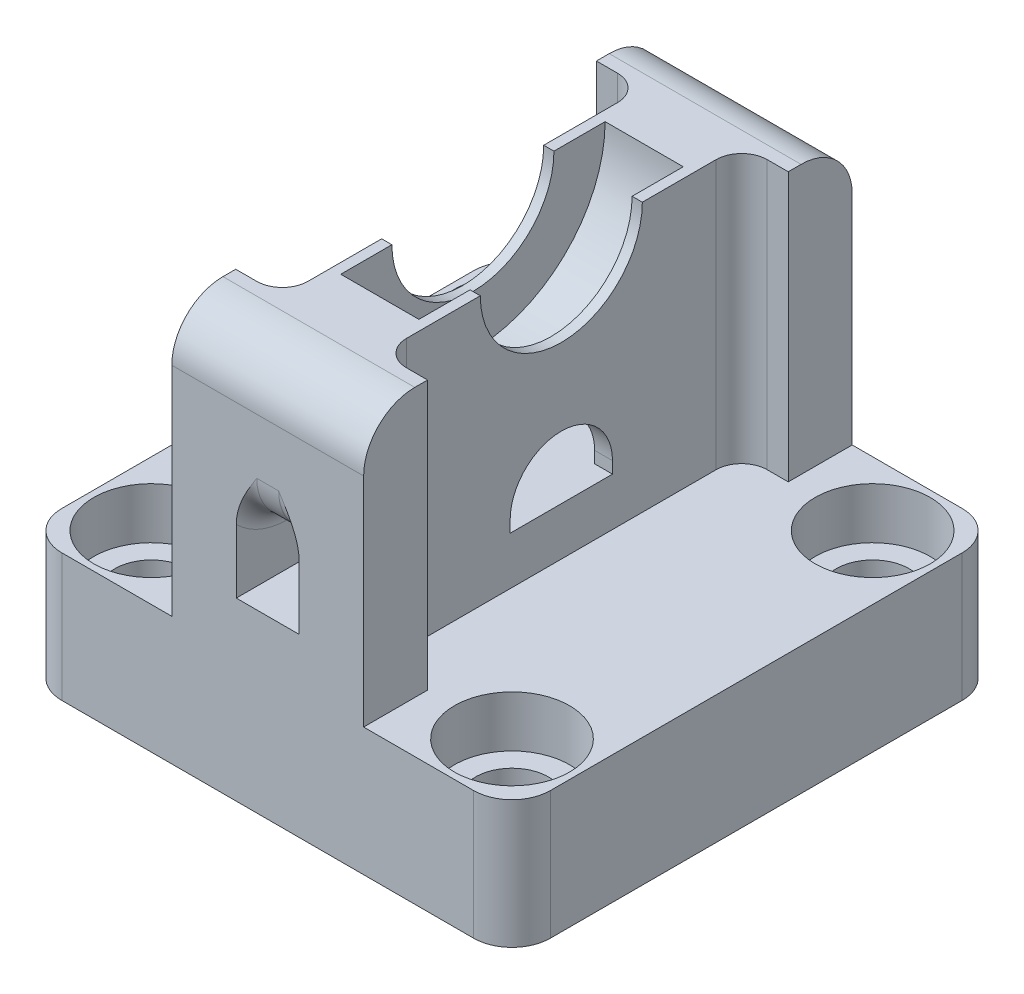
from build123d import *

# Parameters (mm, degrees)
SKETCH1_W           = 48.514
SKETCH1_H           = 48.514
SKETCH1_R           = 3.6195
BOSS_EXTRUDE1_DEPTH = 12.7
FILLET1_R           = 3.81
SKETCH4_R           = 5.715
CUT_EXTRUDE2_DEPTH  = 5.08
BOSS_EXTRUDE3_DEPTH = 26.67
SKETCH8_R           = 13.12545
CUT_EXTRUDE4_DEPTH  = 7.762
SKETCH11_W          = 6.238
SKETCH11_H          = 6.238
CUT_EXTRUDE7_DEPTH  = 68.022437624
SKETCH13_W          = 5.08
SKETCH13_H          = 6.238
CUT_EXTRUDE8_DEPTH  = 55.130822948
SKETCH14_W          = 10.16
SKETCH14_H          = 6.238
BOSS_EXTRUDE4_DEPTH = 1.016
FILLET3_R           = 5.08
FILLET2_R           = 2.54
FILLET4_R           = 2.032
FILLET6_R           = 5.08


# Some blends are built 0.0001 mm under size
with BuildPart() as part:
    # Sketch1 → Boss-Extrude1 (new body)
    with BuildSketch(Plane(origin=(0, 0, 0), x_dir=(1, 0, 0), z_dir=(0, 1, 0))):
        Rectangle(SKETCH1_W, SKETCH1_H)
        with Locations(Location((-17.907, 17.907, 0), (0, 0, 270))):
            Circle(SKETCH1_R, mode=Mode.SUBTRACT)
        with Locations(Location((17.907, 17.907, 0), (0, 0, 270))):
            Circle(SKETCH1_R, mode=Mode.SUBTRACT)
        with Locations(Location((17.907, -17.907, 0), (0, 0, 270))):
            Circle(SKETCH1_R, mode=Mode.SUBTRACT)
        with Locations(Location((-17.907, -17.907, 0), (0, 0, 270))):
            Circle(SKETCH1_R, mode=Mode.SUBTRACT)
    extrude(amount=BOSS_EXTRUDE1_DEPTH)

    # Fillet1
    fillet1_edges = [part.edges().sort_by_distance(p)[0] for p in [
        (24.257, 6.35, 24.257),
        (-24.257, 6.35, 24.257),
        (-24.257, 6.35, -24.257),
        (24.257, 6.35, -24.257),
    ]]
    fillet(fillet1_edges, radius=FILLET1_R)

    # Sketch4 → Cut-Extrude2 (cut)
    with BuildSketch(Plane(origin=(0, 12.7, 0), x_dir=(1, 0, 0), z_dir=(0, 1, 0))):
        with Locations(Location((-17.907, 17.907, 0), (0, 0, 270))):
            Circle(SKETCH4_R)
        with Locations(Location((17.907, -17.907, 0), (0, 0, 270))):
            Circle(SKETCH4_R)
        with Locations(Location((17.907, 17.907, 0), (0, 0, 270))):
            Circle(SKETCH4_R)
        with Locations(Location((-17.907, -17.907, 0), (0, 0, 270))):
            Circle(SKETCH4_R)
    extrude(amount=-CUT_EXTRUDE2_DEPTH, mode=Mode.SUBTRACT)

    # Sketch6 → Boss-Extrude3 (add)
    with BuildSketch(Plane(origin=(0, 12.7, 0), x_dir=(1, 0, 0), z_dir=(0, 1, 0))):
        Polygon((-3.881, 17.907), (-3.881, -17.907), (-9.525, -17.907), (-9.525, -24.257), (9.525, -24.257), (9.525, -17.907), (3.881, -17.907), (3.881, 17.907), (9.525, 17.907), (9.525, 24.257), (-9.525, 24.257), (-9.525, 17.907), align=None)
    extrude(amount=BOSS_EXTRUDE3_DEPTH)

    # Sketch8 → Cut-Extrude4 (cut)
    with BuildSketch(Plane(origin=(3.881, 0, 0), x_dir=(0, 0, -1), z_dir=(1, 0, 0))):
        with Locations((0, 39.37)):
            Circle(SKETCH8_R)
    extrude(amount=-CUT_EXTRUDE4_DEPTH, mode=Mode.SUBTRACT)

    # Sketch11 → Cut-Extrude7 (cut, through all)
    with BuildSketch(Plane.XY.offset(24.257)):
        with Locations((0, 20.58555)):
            Rectangle(SKETCH11_W, SKETCH11_H)
    extrude(amount=-CUT_EXTRUDE7_DEPTH, mode=Mode.SUBTRACT)

    # Sketch13 → Cut-Extrude8 (cut, through all)
    with BuildSketch(Plane(origin=(3.881, 0, 0), x_dir=(0, 0, -1), z_dir=(1, 0, 0))):
        with Locations((-2.54, 20.58555)):
            Rectangle(SKETCH13_W, SKETCH13_H)
        with Locations((2.54, 20.58555)):
            Rectangle(SKETCH13_W, SKETCH13_H)
    extrude(amount=-CUT_EXTRUDE8_DEPTH, mode=Mode.SUBTRACT)

    # Sketch14 → Boss-Extrude4 (add)
    with BuildSketch(Plane(origin=(3.881, 0, 0), x_dir=(0, 0, -1), z_dir=(1, 0, 0))):
        with BuildLine():
            Line((17.907, 39.37), (8.04545, 39.37))
            ThreePointArc((8.04545, 39.37), (0, 31.32455), (-8.04545, 39.37))
            Line((-8.04545, 39.37), (-17.907, 39.37))
            Line((-17.907, 39.37), (-17.907, 12.7))
            Line((-17.907, 12.7), (17.907, 12.7))
            Line((17.907, 12.7), (17.907, 39.37))
        make_face()
        with Locations((0, 20.58555)):
            Rectangle(SKETCH14_W, SKETCH14_H, mode=Mode.SUBTRACT)
    boss_extrude4 = extrude(amount=BOSS_EXTRUDE4_DEPTH)

    # Mirror1: Boss-Extrude4 across plane
    add(boss_extrude4.mirror(Plane(origin=(0, 0, 0), x_dir=(0, 0, 1), z_dir=(1, 0, 0))))

    # Fillet3
    fillet3_edges = [part.edges().sort_by_distance(p)[0] for p in [
        (0, 23.70455, -24.257),
        (0, 23.70455, 24.257),
        (0, 39.37, 24.257),
        (0, 39.37, -24.257),
    ]]
    fillet(fillet3_edges, radius=FILLET3_R)

    # Fillet2
    fillet2_edges = [part.edges().sort_by_distance(p)[0] for p in [
        (4.897, 26.035, -17.907),
        (4.897, 26.035, 17.907),
        (-4.897, 26.035, -17.907),
        (-4.897, 26.035, 17.907),
    ]]
    fillet(fillet2_edges, radius=FILLET2_R)

    # Fillet4
    # the kernel refuses this fillet: 2.032 mm, written as the material it adds along each edge
    with BuildSketch(Plane(origin=(3.119, 23.70455, 19.177), x_dir=(-1, 0, 0), z_dir=(0, 0, -1)), Plane(origin=(3.119, 23.70455, -5.08), x_dir=(-1, 0, 0), z_dir=(0, 0, -1))) as fillet4_piece_1:
        with BuildLine():
            CenterArc((FILLET4_R, -FILLET4_R), FILLET4_R, 90, 90)
            Line((0, -FILLET4_R), (0, 0))
            Line((0, 0), (FILLET4_R, 0))
        make_face()
    extrude(amount=14.097)
    with BuildSketch(Plane(origin=(-3.119, 23.70455, 19.177), x_dir=(1, 0, 0), z_dir=(0, 0, -1)), Plane(origin=(-3.119, 23.70455, -5.08), x_dir=(1, 0, 0), z_dir=(0, 0, -1))) as fillet4_piece_2:
        with BuildLine():
            CenterArc((FILLET4_R, FILLET4_R), FILLET4_R, 180, 90)
            Line((0, FILLET4_R), (0, 0))
            Line((0, 0), (FILLET4_R, 0))
        make_face()
    extrude(amount=14.097)
    with BuildSketch(Plane(origin=(-3.119, 28.78455, -19.177), x_dir=(0, 0.8416879607506225, -0.5399642365263265), z_dir=(0, 0.5399642365263265, 0.8416879607506225))) as fillet4_piece_3_section:
        with BuildLine():
            CenterArc((5.08 + FILLET4_R, -FILLET4_R), FILLET4_R, 90, 90)
            Line((5.08, -FILLET4_R), (5.08, 0))
            Line((5.08, 0), (5.08 + FILLET4_R, 0))
        make_face()
    fillet4_piece_3 = revolve(axis=Axis((-3.119, 28.78455, -19.177), (-1, 0, 0)), revolution_arc=147.318795695, mode=Mode.PRIVATE)
    fillet4_piece_3 = split(fillet4_piece_3, bisect_by=Plane(origin=(-3.119, 28.78455, -24.257), z_dir=(0, 0, 1)), keep=Keep.TOP, mode=Mode.PRIVATE)
    add(fillet4_piece_3)
    with BuildSketch(Plane(origin=(3.119, 28.78455, -19.177), x_dir=(0, 0.8416879607506221, -0.5399642365263271), z_dir=(0, 0.5399642365263271, 0.8416879607506221))) as fillet4_piece_4_section:
        with BuildLine():
            CenterArc((5.08 + FILLET4_R, FILLET4_R), FILLET4_R, 180, 90)
            Line((5.08 + FILLET4_R, 0), (5.08, 0))
            Line((5.08, 0), (5.08, FILLET4_R))
        make_face()
    fillet4_piece_4 = revolve(axis=Axis((3.119, 28.78455, -19.177), (-1, 0, 0)), revolution_arc=147.318795695, mode=Mode.PRIVATE)
    fillet4_piece_4 = split(fillet4_piece_4, bisect_by=Plane(origin=(3.119, 28.78455, -24.257), z_dir=(0, 0, 1)), keep=Keep.TOP, mode=Mode.PRIVATE)
    add(fillet4_piece_4)
    with BuildSketch(Plane(origin=(-3.119, 28.78455, 19.177), x_dir=(0, 0.8416879607506225, 0.5399642365263265), z_dir=(0, 0.5399642365263265, -0.8416879607506225))) as fillet4_piece_5_section:
        with BuildLine():
            CenterArc((5.08 + FILLET4_R, FILLET4_R), FILLET4_R, 180, 90)
            Line((5.08, FILLET4_R), (5.08, 0))
            Line((5.08, 0), (5.08 + FILLET4_R, 0))
        make_face()
    fillet4_piece_5 = revolve(axis=Axis((-3.119, 28.78455, 19.177), (1, 0, 0)), revolution_arc=147.318795695, mode=Mode.PRIVATE)
    fillet4_piece_5 = split(fillet4_piece_5, bisect_by=Plane(origin=(-3.119, 28.78455, 24.257), z_dir=(0, 0, -1)), keep=Keep.TOP, mode=Mode.PRIVATE)
    add(fillet4_piece_5)
    with BuildSketch(Plane(origin=(3.119, 28.78455, 19.177), x_dir=(0, 0.8416879607506221, 0.5399642365263271), z_dir=(0, 0.5399642365263271, -0.8416879607506221))) as fillet4_piece_6_section:
        with BuildLine():
            CenterArc((5.08 + FILLET4_R, -FILLET4_R), FILLET4_R, 90, 90)
            Line((5.08, -FILLET4_R), (5.08, 0))
            Line((5.08, 0), (5.08 + FILLET4_R, 0))
        make_face()
    fillet4_piece_6 = revolve(axis=Axis((3.119, 28.78455, 19.177), (1, 0, 0)), revolution_arc=147.318795695, mode=Mode.PRIVATE)
    fillet4_piece_6 = split(fillet4_piece_6, bisect_by=Plane(origin=(3.119, 28.78455, 24.257), z_dir=(0, 0, -1)), keep=Keep.TOP, mode=Mode.PRIVATE)
    add(fillet4_piece_6)

    # Fillet6
    fillet6_edges = [part.edges().sort_by_distance(p)[0] for p in [
        (-2.992, 23.70455, -5.08),
        (2.992, 23.70455, -5.08),
        (-2.992, 23.70455, 5.08),
        (2.992, 23.70455, 5.08),
    ]]
    fillet(fillet6_edges, radius=FILLET6_R - 0.0001)  # a hair under: the kernel refuses the full size


solid = part.part
